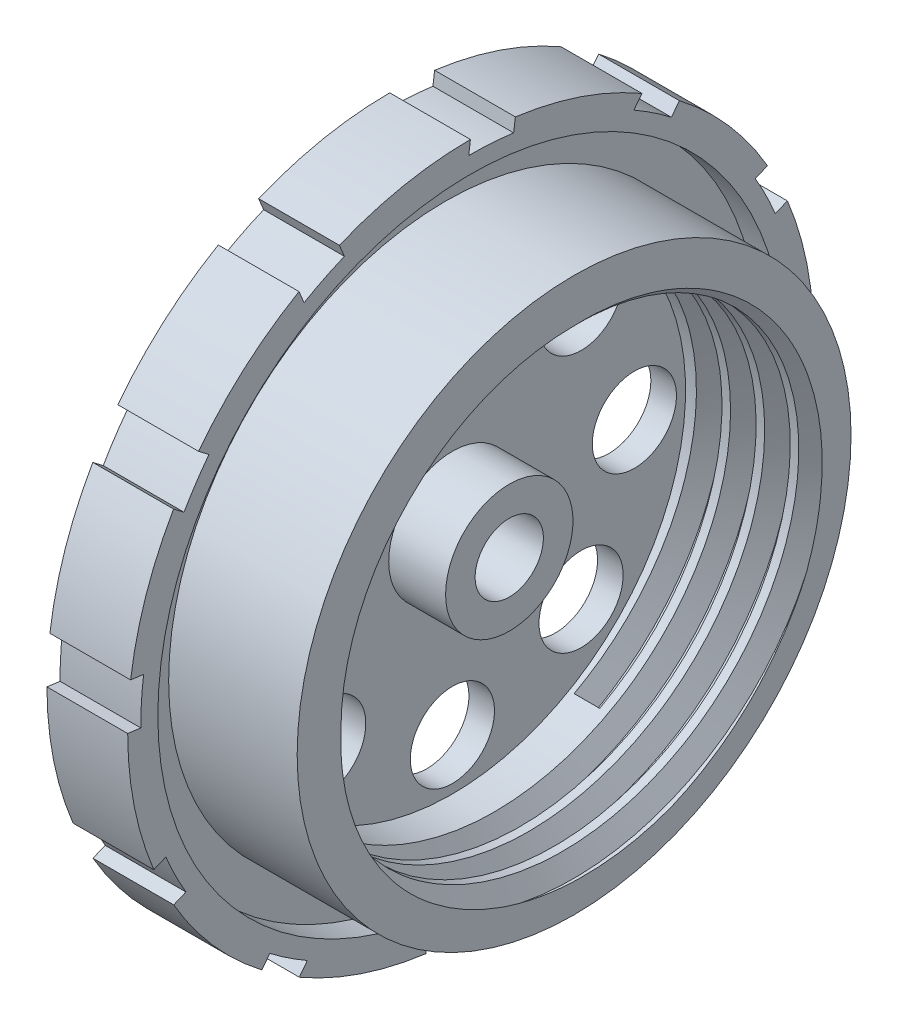
from build123d import *

# Parameters (mm, degrees)
SKETCH2_R          = 3
CUT_EXTRUDE1_DEPTH = 44.912355892
SKETCH3_R          = 3.7
CUT_EXTRUDE2_DEPTH = 10
CIRPATTERN1_COUNT  = 8
CUT_EXTRUDE3_DEPTH = 46.612333858
CIRPATTERN2_COUNT  = 12
THREAD1_PITCH      = 3


with BuildPart() as part:
    # Sketch1 → Revolve1 (revolve)
    with BuildSketch(Plane.XY, mode=Mode.PRIVATE) as revolve1_sk:
        Polygon((3.25, 0), (3.25, 26.75), (0, 26.75), (0, 30.15), (7.1, 30.15), (7.1, 27.5), (4.9, 27.5), (4.9, 24.35), (16.2, 24.35), (16.2, 20.5), (5.5, 20.5), (5.5, 5.6), (10.5, 5.6), (10.5, 0), align=None)
    revolve(revolve1_sk.sketch.rotate(Axis((0, 0, 0), (1, 0, 0)), 90), axis=Axis((0, 0, 0), (1, 0, 0)))

    # Sketch2 → Cut-Extrude1 (cut, through all)
    with BuildSketch(Plane(origin=(10.5, 0, 0), x_dir=(0, 0, -1), z_dir=(1, 0, 0))):
        Circle(SKETCH2_R)
    extrude(amount=-CUT_EXTRUDE1_DEPTH, mode=Mode.SUBTRACT)

    # Sketch3 → Cut-Extrude2 (cut)
    with BuildSketch(Plane.ZY.offset(-3.25)):
        with Locations((16, 0)):
            Circle(SKETCH3_R)
    cut_extrude2 = extrude(amount=-CUT_EXTRUDE2_DEPTH, mode=Mode.SUBTRACT)

    # CirPattern1: Cut-Extrude2 ×8 about axis
    cirpattern1_axis = Axis((0, 0, 0), (1, 0, 0))
    for i in range(1, CIRPATTERN1_COUNT):
        add(cut_extrude2.rotate(cirpattern1_axis, i * 360 / CIRPATTERN1_COUNT), mode=Mode.SUBTRACT)

    # Sketch4 → Cut-Extrude3 (cut, through all)
    with BuildSketch(Plane.ZY):
        with BuildLine():
            Line((26.792506443, -11.097819539), (27.854967905, -11.537905486))
            ThreePointArc((27.854967905, -11.537905486), (27.037447799, -13.341623459), (26.10328176, -15.087782519))
            Line((26.10328176, -15.087782519), (25.031211799, -14.643716601))
            ThreePointArc((25.031211799, -14.643716601), (25.972442888, -12.90086084), (26.792506443, -11.097819539))
        make_face()
    cut_extrude3 = extrude(amount=-CUT_EXTRUDE3_DEPTH, mode=Mode.SUBTRACT)

    # CirPattern2: Cut-Extrude3 ×12 about axis
    cirpattern2_axis = Axis((0, 0, 0), (1, 0, 0))
    for i in range(1, CIRPATTERN2_COUNT):
        add(cut_extrude3.rotate(cirpattern2_axis, i * 360 / CIRPATTERN2_COUNT), mode=Mode.SUBTRACT)

    # Thread1: the profile of Thread Profile1 profile screwed along a right-hand helix of 3.666667 turns, 10 arcs to a turn; built about Z, then put on its axis
    thread1_z = Axis((0, 0, 0), (0, 0, 1))
    thread1_corners = [(20.4997, 0, -0.000173205), (22.123797625, 0, 0.937499996), (22.123797625, 0, 1.312499996), (20.4997, 0, 2.250173197)]
    with BuildLine(mode=Mode.PRIVATE) as thread1_profile:
        Line(thread1_corners[0], thread1_corners[1])
        Line(thread1_corners[1], thread1_corners[2])
        Line(thread1_corners[2], thread1_corners[3])
        Line(thread1_corners[3], thread1_corners[0])
    thread1_cap = Face(thread1_profile.wire())
    thread1_turn_angles = [0, 18, 36, 54, 72, 90, 108, 126, 144, 162, 180, 198, 216, 234, 252, 270, 288, 306, 324, 342, 360]
    thread1_turn_weights = [1, 0.9510565162951535, 1, 0.9510565162951535, 1, 0.9510565162951535, 1, 0.9510565162951535, 1, 0.9510565162951535, 1, 0.9510565162951535, 1, 0.9510565162951535, 1, 0.9510565162951535, 1, 0.9510565162951535, 1, 0.9510565162951535, 1]
    thread1_turn_rails = [Edge.make_bspline([Vector(p[0], p[1], 0).rotate(thread1_z, thread1_turn_angles[k]) / thread1_turn_weights[k] + Vector(0, 0, p[2] + THREAD1_PITCH * thread1_turn_angles[k] / 360) for k in range(21)], [0, 0, 0, 1, 1, 2, 2, 3, 3, 4, 4, 5, 5, 6, 6, 7, 7, 8, 8, 9, 9, 10, 10, 10], 2, thread1_turn_weights) for p in thread1_corners]
    thread1_turn_sides = [Face.make_surface_from_curves(thread1_turn_rails[p[0]], thread1_turn_rails[p[1]]) for p in [(0, 1), (1, 2), (2, 3), (3, 0)]]
    thread1_last_angles = [1080, 1098, 1116, 1134, 1152, 1170, 1188, 1206, 1224, 1242, 1260, 1278, 1296, 1308, 1320]
    thread1_last_weights = [1, 0.9510565162951535, 1, 0.9510565162951535, 1, 0.9510565162951535, 1, 0.9510565162951535, 1, 0.9510565162951535, 1, 0.9510565162951535, 1, 0.9781476007338065, 1]
    thread1_last_rails = [Edge.make_bspline([Vector(p[0], p[1], 0).rotate(thread1_z, thread1_last_angles[k]) / thread1_last_weights[k] + Vector(0, 0, p[2] + THREAD1_PITCH * thread1_last_angles[k] / 360) for k in range(15)], [0, 0, 0, 1, 1, 2, 2, 3, 3, 4, 4, 5, 5, 6, 6, 7, 7, 7], 2, thread1_last_weights) for p in thread1_corners]
    thread1_last_sides = [Face.make_surface_from_curves(thread1_last_rails[p[0]], thread1_last_rails[p[1]]) for p in [(0, 1), (1, 2), (2, 3), (3, 0)]]
    thread1 = Plane(origin=(19.2, 0, 0), x_dir=(0, 0, 1), z_dir=(-1, 0, 0)) * Solid(Shell([*[p.moved(Location((0, 0, THREAD1_PITCH * i))) for i in range(3) for p in thread1_turn_sides], *thread1_last_sides, thread1_cap, thread1_cap.rotate(thread1_z, 1320).moved(Location((0, 0, THREAD1_PITCH * 1320 / 360)))]))
    add(thread1, mode=Mode.SUBTRACT)


solid = part.part
